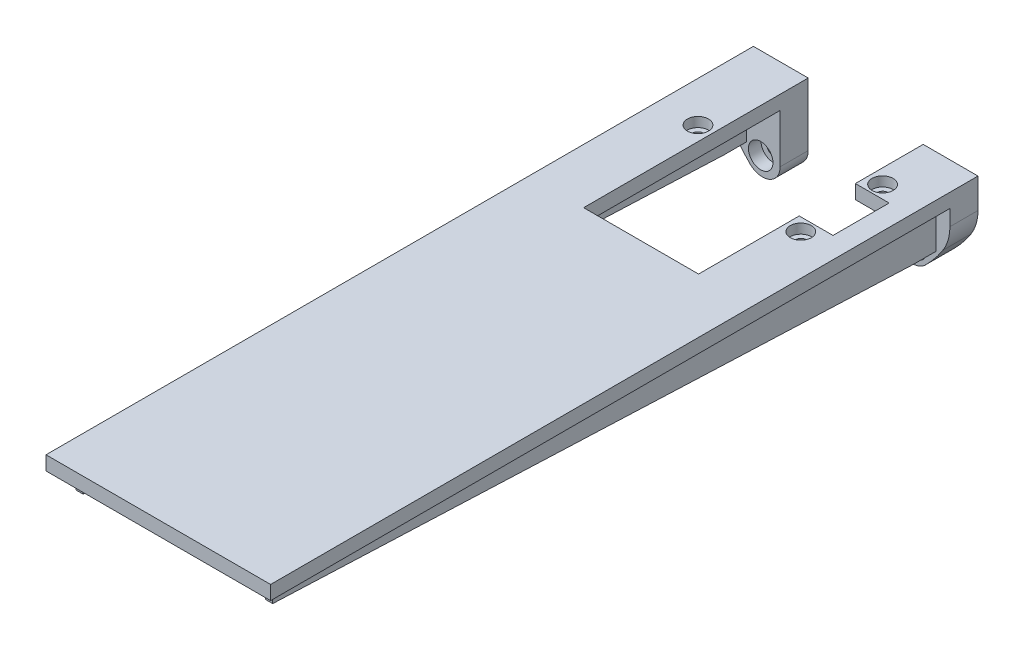
from build123d import *

# Parameters (mm, degrees)
SKETCH1_W                                     = 50.8
SKETCH1_H                                     = 25.4
BASE_FLANGE1_DEPTH                            = 6.35
SKETCH22_W                                    = 50.8
SKETCH22_H                                    = 160
BOSS_EXTRUDE1_DEPTH                           = 3.175
GUSSET1_START                                 = -22.225
GUSSET1_DEPTH                                 = 1.5875
CBORE_FOR_4_SOCKET_HEAD_CAP_SCREW1_AT_2_COUNT = 2
CBORE_FOR_4_SOCKET_HEAD_CAP_SCREW1_AT_2_PITCH = 34.798
SKETCH12_W                                    = 26
SKETCH12_H                                    = 28.575
CUT_EXTRUDE1_DEPTH                            = 50.8
SKETCH13_W                                    = 33.6375
SKETCH13_H                                    = 12.7
CUT_EXTRUDE2_DEPTH                            = 50.8
CBORE_FOR_2_SOCKET_HEAD_CAP_SCREW1_AT_2_COUNT = 2
CBORE_FOR_2_SOCKET_HEAD_CAP_SCREW1_AT_2_PITCH = 33.801054175
CBORE_FOR_2_SOCKET_HEAD_CAP_SCREW1_AT_3_COUNT = 2
CBORE_FOR_2_SOCKET_HEAD_CAP_SCREW1_AT_3_PITCH = 33.801054175
SKETCH17_OUTSIDE_W                            = 86.756
SKETCH17_OUTSIDE_H                            = 61.356
SKETCH17_OUTSIDE_R                            = 28.321
CUT_EXTRUDE3_DEPTH                            = 165.504378741
FILLET1_R                                     = 10
FILLET2_R                                     = 4


# Read off the part's stored shape, not the designer's step: Gusset1
# Sheet-metal steps are written as plain solids
with BuildPart() as part:
    # Sketch1 → Base-Flange1 (new body)
    with BuildSketch(Plane.XY):
        with Locations((0, -15.875)):
            Rectangle(SKETCH1_W, SKETCH1_H)
    extrude(amount=-BASE_FLANGE1_DEPTH)

    # Sketch22 → Boss-Extrude1 (add)
    with BuildSketch(Plane(origin=(0, -3.175, 0), x_dir=(1, 0, 0), z_dir=(0, 1, 0))):
        with Locations((0, -73.65)):
            Rectangle(SKETCH22_W, SKETCH22_H)
    extrude(amount=-BOSS_EXTRUDE1_DEPTH)

    # Sketch11 → CBORE for #4 Socket Head Cap Screw1 (revolve, cut)
    with BuildSketch(Plane(origin=(-17.399, -17.4, 0), x_dir=(0, -1, 0), z_dir=(1, 0, 0))):
        Polygon((0, 0), (0, 6.351), (1.4732, 6.351), (1.4732, 2.8448), (2.77876, 2.8448), (2.77876, 0), align=None)
    cbore_for_4_socket_head_cap_screw1 = revolve(axis=Axis((-17.399, -17.4, 6.35), (0, 0, -1)), mode=Mode.SUBTRACT)

    # CBORE for #4 Socket Head Cap Screw1 at 2: CBORE for #4 Socket Head Cap Screw1 ×2
    with Locations(*[(i * CBORE_FOR_4_SOCKET_HEAD_CAP_SCREW1_AT_2_PITCH, 0, 0) for i in range(1, CBORE_FOR_4_SOCKET_HEAD_CAP_SCREW1_AT_2_COUNT)]):
        add(cbore_for_4_socket_head_cap_screw1, mode=Mode.SUBTRACT)

    # Sketch12 → Cut-Extrude1 (cut)
    with BuildSketch(Plane(origin=(0, 0, -6.35), x_dir=(-1, 0, 0), z_dir=(0, 0, -1))):
        with Locations((0, -14.2875)):
            Rectangle(SKETCH12_W, SKETCH12_H)
    extrude(amount=-CUT_EXTRUDE1_DEPTH, mode=Mode.SUBTRACT)


with BuildPart() as body_2:
    # Gusset1 outline → Gusset1 (new body)
    with BuildSketch(Plane.YZ.offset(GUSSET1_START)):
        Polygon((-16.35, 5), (-16.35, 0), (-6.35, 0), (-6.35, 150), (-10.35, 150), align=None)
    gusset1 = extrude(amount=GUSSET1_DEPTH)


with BuildPart() as part_1:
    add(part.part)

    # Mirror2: Gusset1 across plane
    add(gusset1.mirror(Plane(origin=(0, 0, 0), x_dir=(0, 0, 1), z_dir=(1, 0, 0))))

    # Sketch13 → Cut-Extrude2 (cut)
    with BuildSketch(Plane.XZ.offset(6.35)):
        with Locations((3.81875, 15.335)):
            Rectangle(SKETCH13_W, SKETCH13_H)
    extrude(amount=-CUT_EXTRUDE2_DEPTH, mode=Mode.SUBTRACT)

    # Sketch16 → CBORE for #2 Socket Head Cap Screw1 (revolve, cut)
    with BuildSketch(Plane(origin=(-16.256, -3.175, 15.335), x_dir=(0, 0, 1), z_dir=(1, 0, 0))):
        Polygon((0, 0), (0, 17.242569267), (1.2192, 16.51), (1.2192, 2.1844), (2.38125, 2.1844), (2.38125, 0), align=None)
    cbore_for_2_socket_head_cap_screw1 = revolve(axis=Axis((-16.256, 3.175, 15.335), (0, -1, 0)), mode=Mode.SUBTRACT)

    # CBORE for #2 Socket Head Cap Screw1 at 2: CBORE for #2 Socket Head Cap Screw1 ×2
    with Locations(*[Vector(0.9618634919315714, 0, 0.27352993051804053) * (i * CBORE_FOR_2_SOCKET_HEAD_CAP_SCREW1_AT_2_PITCH) for i in range(1, CBORE_FOR_2_SOCKET_HEAD_CAP_SCREW1_AT_2_COUNT)]):
        add(cbore_for_2_socket_head_cap_screw1, mode=Mode.SUBTRACT)

    # CBORE for #2 Socket Head Cap Screw1 at 3: CBORE for #2 Socket Head Cap Screw1 ×2
    with Locations(*[Vector(0.9618634919315714, 0, -0.2735299305180405) * (i * CBORE_FOR_2_SOCKET_HEAD_CAP_SCREW1_AT_3_PITCH) for i in range(1, CBORE_FOR_2_SOCKET_HEAD_CAP_SCREW1_AT_3_COUNT)]):
        add(cbore_for_2_socket_head_cap_screw1, mode=Mode.SUBTRACT)

    # Sketch17 outside → Cut-Extrude3 (cut, through all)
    with BuildSketch(Plane(origin=(0, 0, -6.35), x_dir=(-1, 0, 0), z_dir=(0, 0, -1))):
        with Locations((0, -15.875)):
            Rectangle(SKETCH17_OUTSIDE_W, SKETCH17_OUTSIDE_H)
        Circle(SKETCH17_OUTSIDE_R, mode=Mode.SUBTRACT)
    extrude(amount=-CUT_EXTRUDE3_DEPTH, mode=Mode.SUBTRACT)

    # Fillet1
    fillet1_edges = [part_1.edges().sort_by_distance(p)[0] for p in [
        (25.4, -12.526733054, -3.175),
        (-25.4, -12.526733054, -3.175),
    ]]
    fillet(fillet1_edges, radius=FILLET1_R)

    # Fillet2
    fillet2_edges = [part_1.edges().sort_by_distance(p)[0] for p in [
        (-13, -25.161062001, -3.175),
        (13, -25.161062001, -3.175),
    ]]
    fillet(fillet2_edges, radius=FILLET2_R)


solid = Compound([body_2.part, part_1.part])
